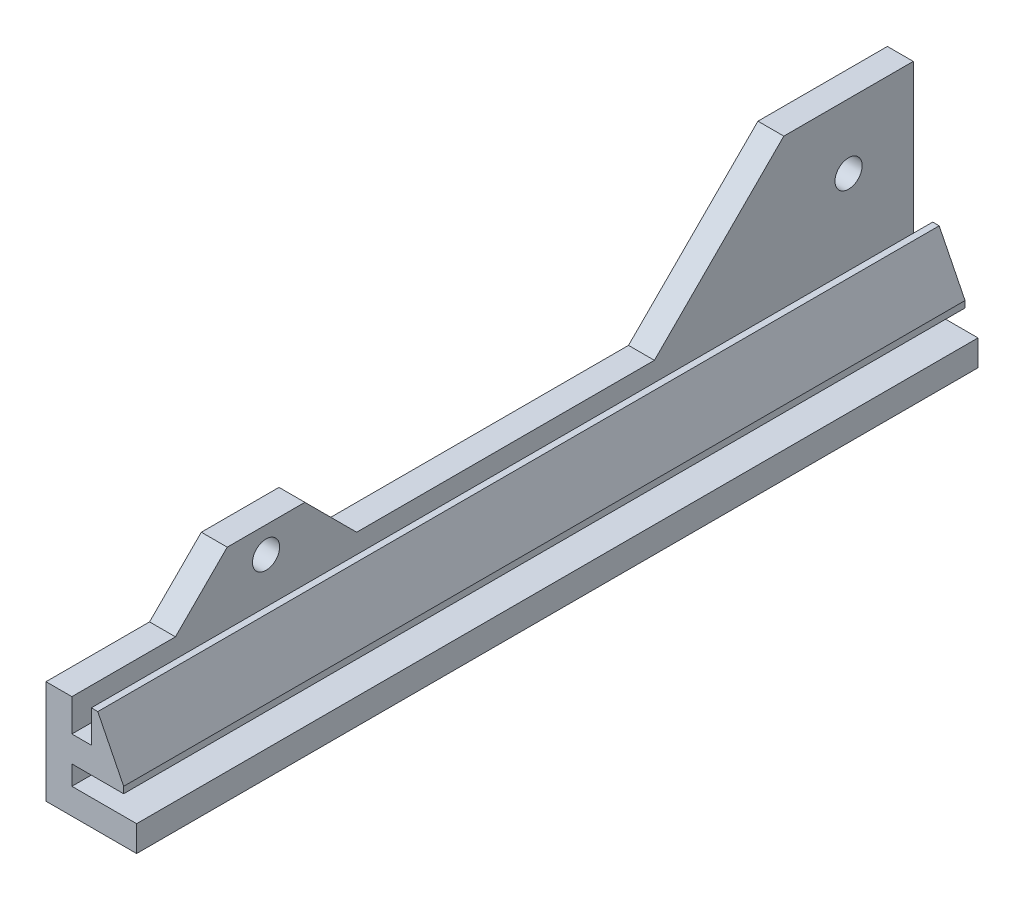
from build123d import *

# Parameters (mm, degrees)
DODANIE_WYCI_GNI_CIE1_DEPTH = 130
SZKIC2_R                    = 2.1
SZKIC2_W                    = 12
SZKIC2_H                    = 8
DODANIE_WYCI_GNI_CIE2_DEPTH = 4
SFAZOWANIE1_SIZE            = 8


with BuildPart() as part:
    # Szkic1 → Dodanie-wyciągnięcie1 (new body)
    with BuildSketch(Plane.XY):
        Polygon((0, 0), (14, 0), (14, 4), (4, 4), (4, 7), (12, 7), (12, 8), (8, 16), (7, 16), (7, 11), (4, 11), (4, 16), (0, 16), align=None)
    extrude(amount=DODANIE_WYCI_GNI_CIE1_DEPTH)

    # Szkic2 → Dodanie-wyciągnięcie2 (add)
    # profile 1 of 2: a face of its own
    with BuildSketch(Plane.ZY):
        Polygon((20, 36), (40, 16), (20, 16), (0, 16), (0, 36), align=None)
        with Locations((10, 26)):
            Circle(SZKIC2_R, mode=Mode.SUBTRACT)
    # profile 2 of 2: a face of its own
    with BuildSketch(Plane.ZY):
        with Locations((100, 20)):
            Rectangle(SZKIC2_W, SZKIC2_H)
        with Locations((100, 20)):
            Circle(SZKIC2_R, mode=Mode.SUBTRACT)
    extrude(amount=-DODANIE_WYCI_GNI_CIE2_DEPTH)

    # Sfazowanie1
    sfazowanie1_edges = [part.edges().sort_by_distance(p)[0] for p in [
        (2, 16, 94),
        (2, 16, 106),
    ]]
    chamfer(sfazowanie1_edges, length=SFAZOWANIE1_SIZE - 0.0001)  # a hair under: the kernel refuses the full size


solid = part.part
